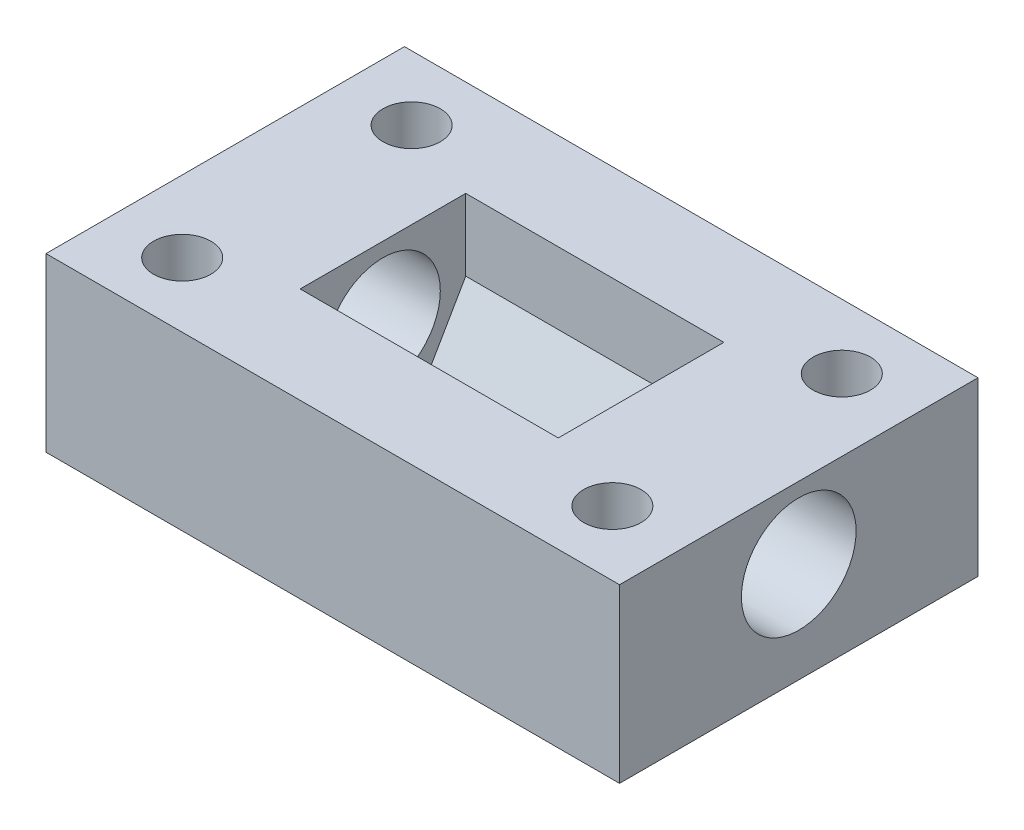
from build123d import *

# Parameters (mm, degrees)
SKETCH1_W               = 40
SKETCH1_H               = 25
BOSS_EXTRUDE1_DEPTH     = 12
CUT_EXTRUDE1_DEPTH      = 9
CUT_EXTRUDE1_DEPTH_BACK = 9
CUT_EXTRUDE2_DEPTH      = 27.462237245
CUT_EXTRUDE2_DEPTH_BACK = 27.462237245
SKETCH3_R               = 4
CUT_EXTRUDE3_DEPTH      = 27.462237245
CUT_EXTRUDE3_DEPTH_BACK = 27.462237245
SKETCH4_R               = 2


with BuildPart() as part:
    # Sketch1 → Boss-Extrude1 (new body)
    with BuildSketch(Plane(origin=(0, 0, 0), x_dir=(1, 0, 0), z_dir=(0, 1, 0))):
        Rectangle(SKETCH1_W, SKETCH1_H)
    extrude(amount=BOSS_EXTRUDE1_DEPTH)

    # Sketch2 → Cut-Extrude1 (cut, two sides: drawn at the far end of the back side and taken through both)
    with BuildSketch(Plane(origin=(0, 0, 0), x_dir=(0, 0, -1), z_dir=(1, 0, 0)).offset(-CUT_EXTRUDE1_DEPTH_BACK)):
        Polygon((-2.886751346, 2), (2.886751346, 2), (5.773502692, 7), (5.773502692, 12), (-5.773502692, 12), (-5.773502692, 7), align=None)
    extrude(amount=CUT_EXTRUDE1_DEPTH + CUT_EXTRUDE1_DEPTH_BACK, mode=Mode.SUBTRACT)

    # Sketch3 → Cut-Extrude2 (cut, two sides: drawn at the far end of the back side and taken through both)
    with BuildSketch(Plane(origin=(0, 0, 0), x_dir=(0, 0, -1), z_dir=(1, 0, 0)).offset(-CUT_EXTRUDE2_DEPTH_BACK)):
        with Locations((0, 7)):
            Circle(SKETCH3_R)
    extrude(amount=CUT_EXTRUDE2_DEPTH + CUT_EXTRUDE2_DEPTH_BACK, mode=Mode.SUBTRACT)

    # Sketch4 → Cut-Extrude3 (cut, two sides: drawn at the far end of the back side and taken through both)
    with BuildSketch(Plane(origin=(0, 12, 0), x_dir=(1, 0, 0), z_dir=(0, 1, 0)).offset(-CUT_EXTRUDE3_DEPTH_BACK)):
        with Locations((-15, 8)):
            Circle(SKETCH4_R)
        with Locations((15, 8)):
            Circle(SKETCH4_R)
        with Locations((15, -8)):
            Circle(SKETCH4_R)
        with Locations((-15, -8)):
            Circle(SKETCH4_R)
    extrude(amount=CUT_EXTRUDE3_DEPTH + CUT_EXTRUDE3_DEPTH_BACK, mode=Mode.SUBTRACT)


solid = part.part
